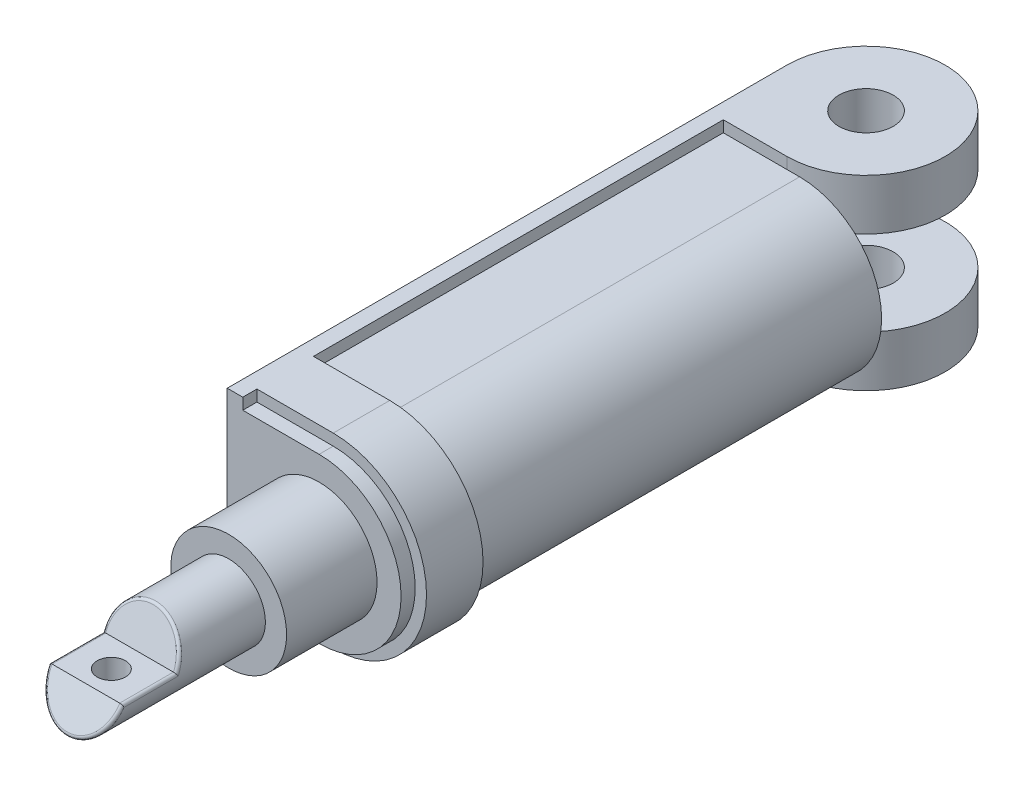
from build123d import *

# Parameters (mm, degrees)
SKETCH_1_R               = 2.4
EXTRUDE_1_DEPTH          = 16.5
EXTRUDE_2_DEPTH          = 42.5
EXTRUDE_START            = -6.25
EXTRUDE_3_DEPTH          = 5
CUT_EXTRUDE_1_DEPTH      = 100.173616703
CUT_EXTRUDE_1_DEPTH_BACK = 100.173616703
CUT_EXTRUDE_2_DEPTH      = 86.750911074
CUT_EXTRUDE_2_DEPTH_BACK = 86.750911074
SKETCH_7_R               = 1.25
FILLET_1_R               = 0.25
CUT_EXTRUDE_3_DEPTH      = 100.072557411
CUT_EXTRUDE_3_DEPTH_BACK = 100.072557411


with BuildPart() as part:
    # 草图1 → 凸台-拉伸1 (new body)
    with BuildSketch(Plane(origin=(0, -50.5, 0), x_dir=(1, 0, 0), z_dir=(0, 1, 0))):
        with BuildLine():
            ThreePointArc((65.375, 17.125), (53.425252532, 22.074747468), (58.375, 10.125))
            Line((58.375, 10.125), (65.375, 10.125))
            Line((65.375, 10.125), (65.375, 17.125))
        make_face()
        with Locations((58.375, 17.125)):
            Circle(SKETCH_1_R, mode=Mode.SUBTRACT)
    extrude(amount=EXTRUDE_1_DEPTH)

    # 草图2 → 凸台-拉伸2 (add)
    with BuildSketch(Plane.XY.offset(-10.125)):
        with BuildLine():
            Line((64, -50.5), (65.375, -50.5))
            Line((65.375, -50.5), (65.375, -34))
            Line((65.375, -34), (64, -34))
            Line((64, -34), (64, -35))
            Line((64, -35), (57.25, -35))
            ThreePointArc((57.25, -35), (50, -42.25), (57.25, -49.5))
            Line((57.25, -49.5), (64, -49.5))
            Line((64, -49.5), (64, -50.5))
        make_face()
    extrude(amount=EXTRUDE_2_DEPTH)

    # 草图3 → 凸台-拉伸3 (add)
    with BuildSketch(Plane.XY.offset(32.375).offset(EXTRUDE_START)):
        with BuildLine():
            ThreePointArc((57.25, -49.5), (50, -42.25), (57.25, -35))
            Line((57.25, -35), (65.375, -35))
            Line((65.375, -35), (65.375, -34))
            Line((65.375, -34), (57.25, -34))
            ThreePointArc((57.25, -34), (49, -42.25), (57.25, -50.5))
            Line((57.25, -50.5), (65.375, -50.5))
            Line((65.375, -50.5), (65.375, -49.5))
            Line((65.375, -49.5), (57.25, -49.5))
        make_face()
    extrude(amount=EXTRUDE_3_DEPTH)

    # 草图5 → 旋转1 (revolve)
    with BuildSketch(Plane(origin=(0, -42.25, 0), x_dir=(1, 0, 0), z_dir=(0, 1, 0))):
        Polygon((62.375, -32.375), (57.25, -32.375), (57.25, -54.875), (60.5, -54.875), (60.5, -40.375), (62.375, -40.375), align=None)
    revolve(axis=Axis((57.25, -42.25, 32.375), (0, 0, 1)))

    # 草图6 → 切除-拉伸1 (cut, two sides: drawn at the far end of the back side and taken through both)
    with BuildSketch(Plane(origin=(0, 0, 0), x_dir=(0, 0, -1), z_dir=(1, 0, 0)).offset(-CUT_EXTRUDE_1_DEPTH_BACK)):
        Polygon((-48.25, -42.25), (-47, -39), (-54.875, -39), (-54.875, -45.5), (-53, -42.25), align=None)
    extrude(amount=CUT_EXTRUDE_1_DEPTH + CUT_EXTRUDE_1_DEPTH_BACK, mode=Mode.SUBTRACT)

    # 草图7 → 切除-拉伸2 (cut, two sides: drawn at the far end of the back side and taken through both)
    with BuildSketch(Plane(origin=(0, -42.25, 0), x_dir=(1, 0, 0), z_dir=(0, 1, 0)).offset(-CUT_EXTRUDE_2_DEPTH_BACK)):
        with Locations((57.25, -50.75)):
            Circle(SKETCH_7_R)
    extrude(amount=CUT_EXTRUDE_2_DEPTH + CUT_EXTRUDE_2_DEPTH_BACK, mode=Mode.SUBTRACT)

    # 圆角1
    fillet_1_edges = [part.edges().sort_by_distance(p)[0] for p in [
        (59.628523426, -44.464751975, 54.277741524),
        (54, -42.25, 50.625),
        (60.5, -42.25, 50.625),
        (59.587314609, -39.99180151, 47.381462119),
    ]]
    fillet(fillet_1_edges, radius=FILLET_1_R)

    # 草图8 → 切除-拉伸3 (cut, two sides: drawn at the far end of the back side and taken through both)
    with BuildSketch(Plane(origin=(0, 0, 0), x_dir=(0, 0, -1), z_dir=(1, 0, 0)).offset(-CUT_EXTRUDE_3_DEPTH_BACK)):
        Polygon((25.79116453, -38.5), (10.125, -38.5), (10.125, -46), (25.79116453, -46), (25.79116453, -42.25), align=None)
    extrude(amount=CUT_EXTRUDE_3_DEPTH + CUT_EXTRUDE_3_DEPTH_BACK, mode=Mode.SUBTRACT)


with BuildPart() as body_2:
    # 镜向2: mirrored copy
    add(part.part.mirror(Plane(origin=(0, 0, 0), x_dir=(0, 0, 1), z_dir=(1, 0, 0))))


solid = body_2.part
